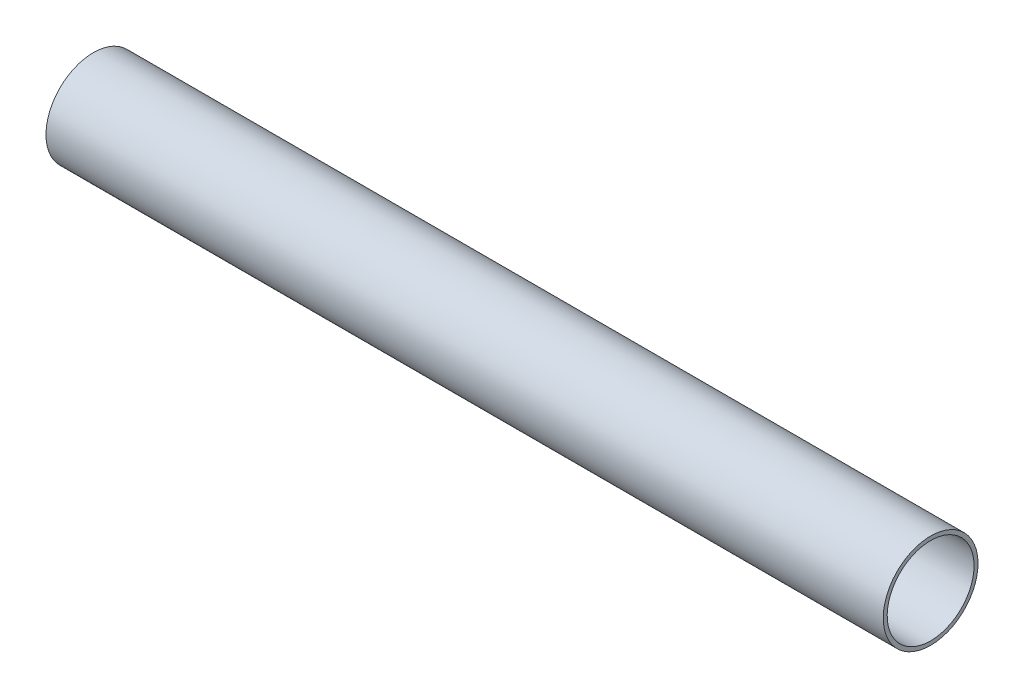
from build123d import *

# Parameters (mm, degrees)
SKETCH1_R           = 12
SKETCH1_R_2         = 11
BOSS_EXTRUDE1_DEPTH = 106


with BuildPart() as part:
    # Sketch1 → Boss-Extrude1 (new, symmetric)
    with BuildSketch(Plane.ZY.offset(15.527905639)):
        with Locations((50, 105.869562716)):
            Circle(SKETCH1_R)
        with Locations((50, 105.869562716)):
            Circle(SKETCH1_R_2, mode=Mode.SUBTRACT)
    extrude(amount=BOSS_EXTRUDE1_DEPTH, both=True)


solid = part.part
